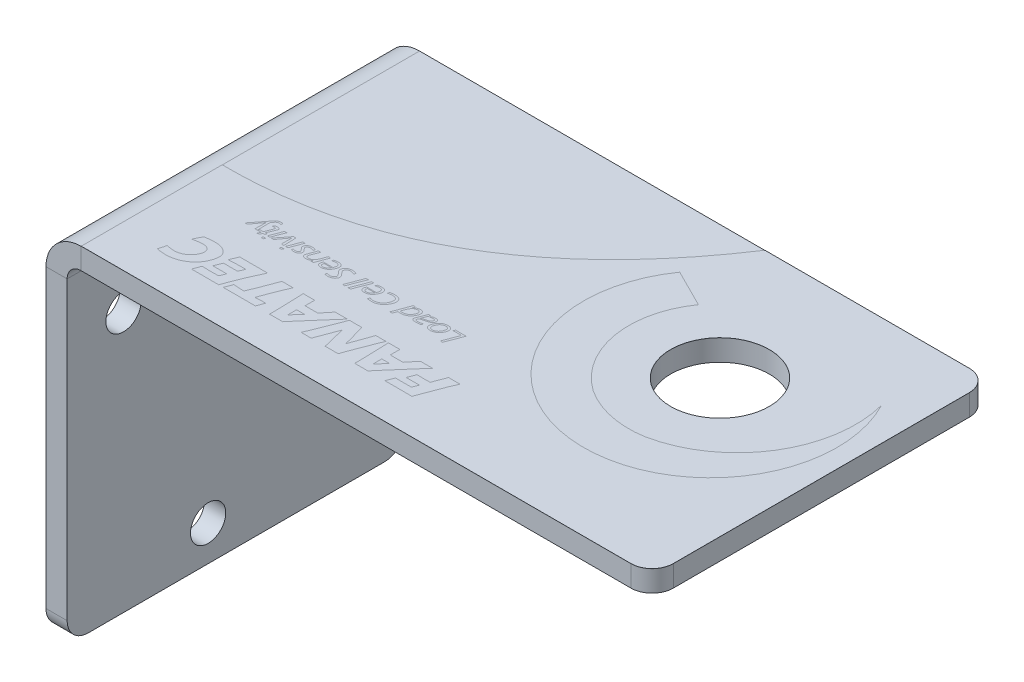
from build123d import *

# Parameters (mm, degrees)
T_LE_DE_BASE_PLI_E1_DEPTH = 24
CONG_1_R                  = 1.5
BOSS_EXTRU_1_DEPTH        = 0.01
ESQUISSE8_R               = 3.5
ENL_V_MAT_EXTRU_1_DEPTH   = 56.231332714
ESQUISSE9_R               = 1.25
ENL_V_MAT_EXTRU_2_DEPTH   = 55.071712735


# Sheet-metal steps are written as plain solids
with BuildPart() as part:
    # Esquisse1 → Tôle de base pliée1 (new body)
    with BuildSketch(Plane.XY):
        with BuildLine():
            Line((0, 0), (0, 22.5))
            ThreePointArc((0, 22.5), (0.732233047, 24.267766953), (2.5, 25))
            Line((2.5, 25), (43, 25))
            Line((43, 25), (43, 23.5))
            Line((43, 23.5), (2.5, 23.5))
            ThreePointArc((2.5, 23.5), (1.792893219, 23.207106781), (1.5, 22.5))
            Line((1.5, 22.5), (1.5, 0))
            Line((1.5, 0), (0, 0))
        make_face()
    extrude(amount=T_LE_DE_BASE_PLI_E1_DEPTH)

    # Congé1
    cong_1_edges = [part.edges().sort_by_distance(p)[0] for p in [
        (0.75, 0, 24),
        (43, 24.25, 24),
        (0.75, 0, 0),
        (43, 24.25, 0),
    ]]
    fillet(cong_1_edges, radius=CONG_1_R)


with BuildPart() as body_2:
    # Esquisse6 → Boss.-Extru.1 (new body)
    with BuildSketch(Plane(origin=(0, 25, 0), x_dir=(1, 0, 0), z_dir=(0, 1, 0))):
        with BuildLine():
            Line((2.5, -24), (2.5, -14))
            add(Edge.make_bspline(
                [(27, 0), (17.679807393, -14.145842157), (2.5, -14)],
                knots=[0, 0, 0, 1, 1, 1], degree=2))
            Line((27, 0), (41.5, 0))
            ThreePointArc((41.5, 0), (42.560660172, -0.439339828), (43, -1.5))
            Line((43, -1.5), (43, -22.5))
            ThreePointArc((43, -22.5), (42.560660172, -23.560660172), (41.5, -24))
            Line((41.5, -24), (2.5, -24))
        make_face()
    extrude(amount=BOSS_EXTRU_1_DEPTH)


with BuildPart() as enl_v_mat_extru_1_tool:
    # Esquisse8 → Enlèv. mat.-Extru.1 (new, through all)
    with BuildSketch(Plane(origin=(0, 25.01, 0), x_dir=(1, 0, 0), z_dir=(0, 1, 0))):
        with Locations(Location((33.252498677, -9.440590145, 0), (0, 0, 270))):
            Circle(ESQUISSE8_R)
    extrude(amount=-ENL_V_MAT_EXTRU_1_DEPTH)


with BuildPart() as part_1:
    add(part.part)

    # Enlèv. mat.-Extru.1: cut by enl_v_mat_extru_1_tool
    add(enl_v_mat_extru_1_tool.part, mode=Mode.SUBTRACT)

    # Esquisse9 → Enlèv. mat.-Extru.2 (cut, through all)
    with BuildSketch(Plane(origin=(1.5, 0, 0), x_dir=(0, 0, -1), z_dir=(1, 0, 0))):
        with Locations((-8, 18.5)):
            Circle(ESQUISSE9_R)
        with Locations((-20, 18.5)):
            Circle(ESQUISSE9_R)
        with Locations((-14, 2.5)):
            Circle(ESQUISSE9_R)
    extrude(amount=-ENL_V_MAT_EXTRU_2_DEPTH, mode=Mode.SUBTRACT)


with BuildPart() as body_2_1:
    add(body_2.part)

    # Enlèv. mat.-Extru.1: cut by enl_v_mat_extru_1_tool
    add(enl_v_mat_extru_1_tool.part, mode=Mode.SUBTRACT)


solid = Compound([part_1.part, body_2_1.part])
